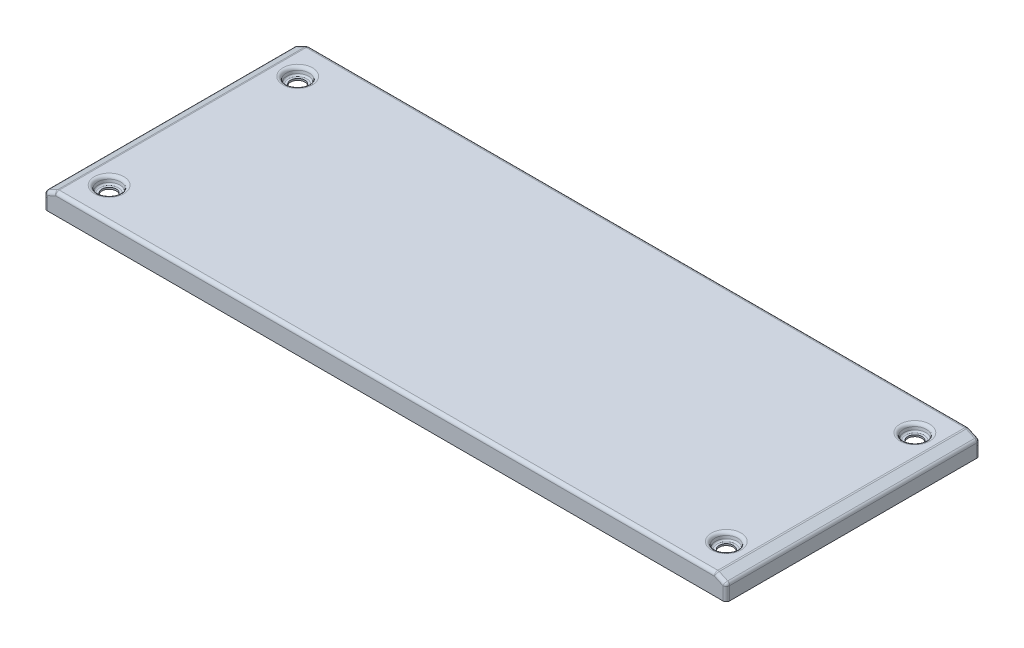
from build123d import *

# Parameters (mm, degrees)
BOSS_EXTRUDE1_DEPTH       = 74
BOSS_EXTRUDE1_DEPTH_BACK  = 74
SKETCH2_R                 = 6.95
CUT_EXTRUDE1_DEPTH        = 4
DRAFT1_ANGLE              = 10
FILLET2_R                 = 1
DRAFT1_OF_MIRROR1_2_ANGLE = 10
FILLET2_OF_MIRROR1_R      = 1
FILLET1_R                 = 2
SHELL1_T                  = -1
CUT_EXTRUDE2_REACH        = 214.464
SKETCH3_R                 = 4.15
MIRROR4_COPY_1_REACH      = 214.464
MIRROR4_COPY_1_SKETCH_R   = 4.15
SKETCH4_R                 = 3
BOSS_EXTRUDE2_DEPTH       = 10


# Read off the part's stored shape, not the designer's step: Mirror2
with BuildPart() as part:
    # Sketch1 → Boss-Extrude1 (new, two sides: drawn at the far end of the back side and taken through both)
    with BuildSketch(Plane.XY.offset(-BOSS_EXTRUDE1_DEPTH_BACK)):
        Polygon((-199, 0), (-199, 9), (-192.5, 12), (192.5, 12), (199, 9), (199, 0), align=None)
    extrude(amount=BOSS_EXTRUDE1_DEPTH + BOSS_EXTRUDE1_DEPTH_BACK)

    # Sketch2 → Cut-Extrude1 (cut)
    with BuildSketch(Plane(origin=(0, 12, 0), x_dir=(1, 0, 0), z_dir=(0, 1, 0))):
        with Locations(Location((-180, 55, 0), (0, 0, 180))):
            Circle(SKETCH2_R)
    cut_extrude1 = extrude(amount=-CUT_EXTRUDE1_DEPTH, mode=Mode.SUBTRACT)

    # Draft1
    draft1_faces = [part.faces().sort_by_distance(p)[0] for p in [
        (-173.05, 10, -55),
    ]]
    draft(draft1_faces, Plane(origin=(-192.5, 12, -74), x_dir=(1, 0, 0), z_dir=(0, 1, 0)), DRAFT1_ANGLE)

    # Fillet2
    fillet2_edges = [part.edges().sort_by_distance(p)[0] for p in [
        (-173.755307923, 8, -55),
    ]]
    fillet(fillet2_edges, radius=FILLET2_R)

    # Mirror1: Cut-Extrude1 across plane
    add(cut_extrude1.mirror(Plane(origin=(0, 0, 0), x_dir=(0, 0, 1), z_dir=(1, 0, 0))), mode=Mode.SUBTRACT)

    # Draft1 of Mirror1 2
    draft1_of_mirror1_2_faces = [part.faces().sort_by_distance(p)[0] for p in [
        (173.05, 10, -55),
    ]]
    draft(draft1_of_mirror1_2_faces, Plane(origin=(192.5, 12, -74), x_dir=(-1, 0, 0), z_dir=(0, 1, 0)), DRAFT1_OF_MIRROR1_2_ANGLE)

    # Fillet2 of Mirror1
    fillet2_of_mirror1_edges = [part.edges().sort_by_distance(p)[0] for p in [
        (173.755307923, 8, -55),
    ]]
    fillet(fillet2_of_mirror1_edges, radius=FILLET2_OF_MIRROR1_R)

    # Mirror2 outline → Mirror2 (revolve, cut)
    with BuildSketch(Plane(origin=(180, 0, 55), x_dir=(1, 0, 0), z_dir=(0, 0, 1))):
        with BuildLine():
            Line((0, 12), (0, 8))
            Line((0, 8), (5.405592446, 8))
            ThreePointArc((5.405592446, 8), (6.048380056, 8.233955557), (6.390400199, 8.826351822))
            Line((6.390400199, 8.826351822), (6.95, 12))
            Line((6.95, 12), (0, 12))
        make_face()
    revolve(axis=Axis((180, 0, 55), (0, 1, 0)), mode=Mode.SUBTRACT)

    # Mirror2 2 outline → Mirror2 2 (revolve, cut)
    with BuildSketch(Plane(origin=(-180, 0, 55), x_dir=(1, 0, 0), z_dir=(0, 0, 1))):
        with BuildLine():
            Line((0, 12), (0, 8))
            Line((0, 8), (5.405592446, 8))
            ThreePointArc((5.405592446, 8), (6.048380056, 8.233955557), (6.390400199, 8.826351822))
            Line((6.390400199, 8.826351822), (6.95, 12))
            Line((6.95, 12), (0, 12))
        make_face()
    revolve(axis=Axis((-180, 0, 55), (0, 1, 0)), mode=Mode.SUBTRACT)

    # Fillet1
    fillet1_edges = [part.edges().sort_by_distance(p)[0] for p in [
        (195.75, 10.5, -74),
        (-199, 9, 0),
        (-192.5, 12, 0),
        (192.5, 12, 0),
        (199, 9, 0),
        (0, 12, -74),
        (-195.75, 10.5, -74),
        (199, 4.5, 74),
        (195.75, 10.5, 74),
        (0, 12, 74),
        (-195.75, 10.5, 74),
        (-199, 4.5, -74),
        (-199, 4.5, 74),
        (-173.05, 12, -55),
        (173.05, 12, -55),
        (173.05, 12, 55),
        (-186.95, 12, 55),
        (199, 4.5, -74),
    ]]
    fillet(fillet1_edges, radius=FILLET1_R)

    # Shell1
    shell1_openings = [part.faces().sort_by_distance(p)[0] for p in [
        (0, 0, 0),
    ]]
    offset(amount=SHELL1_T, openings=shell1_openings, kind=Kind.INTERSECTION)

    # Sketch3 → Cut-Extrude2 (cut, up to next)
    with BuildSketch(Plane(origin=(0, 8, 0), x_dir=(1, 0, 0), z_dir=(0, 1, 0)), mode=Mode.PRIVATE) as cut_extrude2_sk1:
        with Locations(Location((-180, 55, 0), (0, 0, 180))):
            Circle(SKETCH3_R)
    cut_extrude2_tool1 = extrude(cut_extrude2_sk1.sketch, amount=-CUT_EXTRUDE2_REACH, mode=Mode.PRIVATE) & part.part
    cut_extrude2 = cut_extrude2_tool1.solids().sort_by_distance((-180, 8, -55))[0]
    add(cut_extrude2, mode=Mode.SUBTRACT)

    # Mirror3: Cut-Extrude2 across plane
    add(cut_extrude2.mirror(Plane.XY), mode=Mode.SUBTRACT)

    # Mirror4: Cut-Extrude2 across plane
    add(cut_extrude2.mirror(Plane(origin=(0, 0, 0), x_dir=(0, 0, 1), z_dir=(1, 0, 0))), mode=Mode.SUBTRACT)

    # Mirror4 copy 1 sketch → Mirror4 copy 1 (cut, up to next)
    with BuildSketch(Plane(origin=(0, 8, 0), x_dir=(-1, 0, 0), z_dir=(0, 1, 0)), mode=Mode.PRIVATE) as mirror4_copy_1_sk1:
        with Locations(Location((-180, 55, 0), (0, 0, 180))):
            Circle(MIRROR4_COPY_1_SKETCH_R)
    mirror4_copy_1_tool1 = extrude(mirror4_copy_1_sk1.sketch, amount=-MIRROR4_COPY_1_REACH, mode=Mode.PRIVATE) & part.part
    add(mirror4_copy_1_tool1.solids().sort_by_distance((180, 8, 55))[0], mode=Mode.SUBTRACT)

    # Sketch4 → Boss-Extrude2 (add)
    with BuildSketch(Plane.XZ.offset(-11)):
        with Locations(Location((174, 24, 0), (0, 0, 180))):
            Circle(SKETCH4_R)
    extrude(amount=BOSS_EXTRUDE2_DEPTH)


solid = part.part
